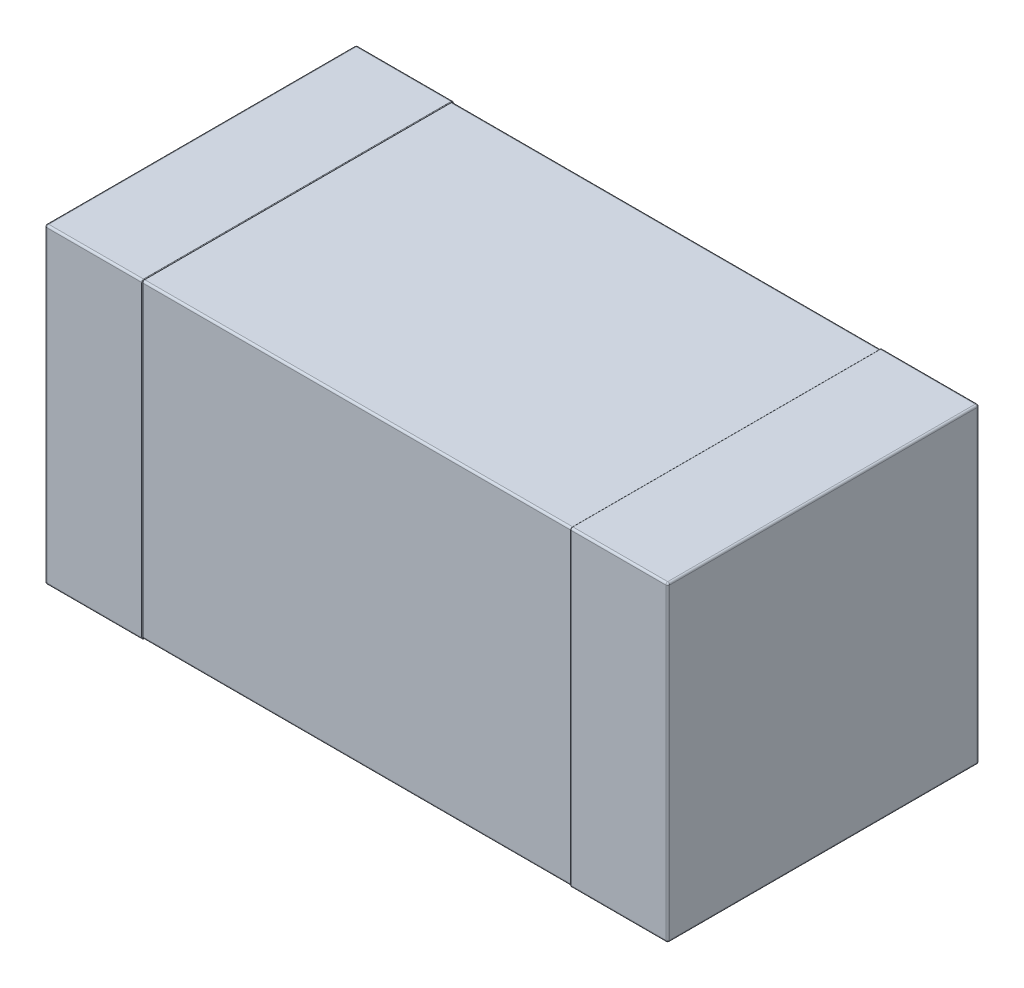
from build123d import *

# Parameters (mm, degrees)
SKETCH1_W                           = 3.2
SKETCH1_H                           = 1.6
ALL_BODY_DEPTH                      = 1.6
CUT_OUT_THE_BODY_FOR_PIN_DEPTH      = 1.1
CUT_OUT_THE_BODY_FOR_PIN_DEPTH_BACK = 1.1
SKETCH2_OUTSIDE_W                   = 4.384
SKETCH2_OUTSIDE_H                   = 4.384
SKETCH2_OUTSIDE_W_2                 = 1.594
SKETCH2_OUTSIDE_H_2                 = 1.594
BODY_FILLET_R                       = 0.01
PIN_FILLET_A_R                      = 0.01
PIN_FILLET_B_R                      = 0.003


with BuildPart() as part:
    # Sketch1 → All body (new body)
    with BuildSketch(Plane.XY):
        Rectangle(SKETCH1_W, SKETCH1_H)
    extrude(amount=ALL_BODY_DEPTH)

    # Sketch2 outside → Cut out the body for pin (cut, two sides: drawn at the far end of the back side and taken through both)
    with BuildSketch(Plane(origin=(0, 0, 0), x_dir=(0, 0, -1), z_dir=(1, 0, 0)).offset(-CUT_OUT_THE_BODY_FOR_PIN_DEPTH_BACK)):
        with Locations((-0.8, 0)):
            Rectangle(SKETCH2_OUTSIDE_W, SKETCH2_OUTSIDE_H)
        with Locations((-0.8, 0)):
            Rectangle(SKETCH2_OUTSIDE_W_2, SKETCH2_OUTSIDE_H_2, mode=Mode.SUBTRACT)
    extrude(amount=CUT_OUT_THE_BODY_FOR_PIN_DEPTH + CUT_OUT_THE_BODY_FOR_PIN_DEPTH_BACK, mode=Mode.SUBTRACT)

    # Body fillet
    body_fillet_edges = [part.edges().sort_by_distance(p)[0] for p in [
        (0, 0.797, 0.003),
        (0, 0.797, 1.597),
        (0, -0.797, 1.597),
        (0, -0.797, 0.003),
    ]]
    fillet(body_fillet_edges, radius=BODY_FILLET_R)

    # Pin fillet a
    pin_fillet_a_edges = [part.edges().sort_by_distance(p)[0] for p in [
        (1.6, 0, 1.6),
        (-1.35, 0.8, 0),
        (1.35, -0.8, 0),
        (1.35, -0.8, 1.6),
        (-1.35, 0.8, 1.6),
        (1.35, 0.8, 1.6),
        (-1.6, 0, 1.6),
        (1.35, 0.8, 0),
        (1.6, 0, 0),
        (-1.35, -0.8, 0),
        (-1.6, 0, 0),
        (-1.6, 0.8, 0.8),
        (1.6, 0.8, 0.8),
        (1.6, -0.8, 0.8),
        (-1.6, -0.8, 0.8),
        (-1.35, -0.8, 1.6),
    ]]
    fillet(pin_fillet_a_edges, radius=PIN_FILLET_A_R)

    # Pin fillet b
    pin_fillet_b_edges = [part.edges().sort_by_distance(p)[0] for p in [
        (1.1, -0.8, 0.8),
        (1.1, 0, 1.6),
        (1.1, 0.8, 0.8),
        (1.1, 0, 0),
        (-1.1, 0.8, 0.8),
        (-1.1, 0, 1.6),
        (-1.1, -0.8, 0.8),
        (-1.1, 0, 0),
        (1.1, 0.797071068, 0.002928932),
        (1.1, -0.797071068, 0.002928932),
        (1.1, -0.797071068, 1.597071068),
        (1.1, 0.797071068, 1.597071068),
        (-1.1, -0.797071068, 1.597071068),
        (-1.1, 0.797071068, 1.597071068),
        (-1.1, -0.797071068, 0.002928932),
        (-1.1, 0.797071068, 0.002928932),
    ]]
    fillet(pin_fillet_b_edges, radius=PIN_FILLET_B_R - 0.0001)  # a hair under: the kernel refuses the full size


solid = part.part
